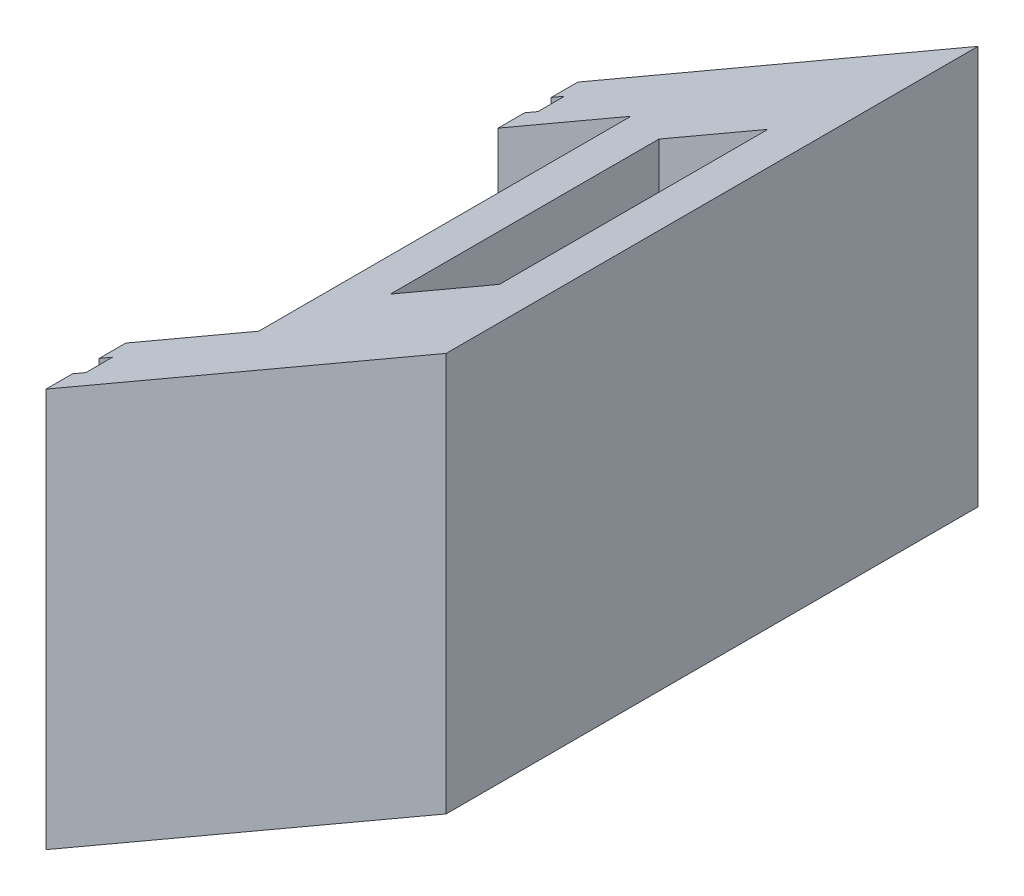
from build123d import *

# Parameters (mm, degrees)
SKETCH2_W             = 10
SKETCH2_H             = 20
BOSS_EXTRUDE1_DEPTH   = 15
SKETCH3_W             = 4.1
SKETCH3_H             = 10.1
CUT_EXTRUDE1_DEPTH    = 19.708286934
SKETCH4_W             = 2.95
SKETCH4_H             = 4.95
CUT_EXTRUDE2_DEPTH    = 15
SKETCH6_W             = 20
SKETCH6_H             = 15
BOSS_EXTRUDE2_DEPTH   = 3
BOSS_EXTRUDE3_DEPTH   = 5
CUT_EXTRUDE3_DEPTH    = 27.944433562
CUT_EXTRUDE4_DEPTH    = 0.5
BOSS_EXTRUDE6_START   = -10
BOSS_EXTRUDE6_DEPTH   = 20
BOSS_EXTRUDE6_2_DEPTH = 4.95
BOSS_EXTRUDE6_START_2 = 5.05
BOSS_EXTRUDE6_3_DEPTH = 4.95
BOSS_EXTRUDE6_4_DEPTH = 3
BOSS_EXTRUDE6_START_3 = 7
BOSS_EXTRUDE6_5_DEPTH = 3
BOSS_EXTRUDE6_6_DEPTH = 1
BOSS_EXTRUDE6_START_4 = -8
BOSS_EXTRUDE6_7_DEPTH = 1
BOSS_EXTRUDE6_8_DEPTH = 1
BOSS_EXTRUDE6_START_5 = 9
BOSS_EXTRUDE6_9_DEPTH = 1


# Read off the part's stored shape, not the designer's step: Boss-Extrude6
with BuildPart() as part:
    # Sketch2 → Boss-Extrude1 (new body)
    with BuildSketch(Plane(origin=(0, 0, 0), x_dir=(1, 0, 0), z_dir=(0, 1, 0))):
        Rectangle(SKETCH2_W, SKETCH2_H)
    extrude(amount=BOSS_EXTRUDE1_DEPTH)

    # Sketch3 → Cut-Extrude1 (cut, through all)
    with BuildSketch(Plane(origin=(0, 15, 0), x_dir=(1, 0, 0), z_dir=(0, 1, 0))):
        Rectangle(SKETCH3_W, SKETCH3_H)
    extrude(amount=-CUT_EXTRUDE1_DEPTH, mode=Mode.SUBTRACT)

    # Sketch4 → Cut-Extrude2 (cut)
    with BuildSketch(Plane(origin=(0, 15, 0), x_dir=(1, 0, 0), z_dir=(0, 1, 0))):
        Polygon((-2.05, 10), (-5, 10), (-5, -5.05), (-2.05, -5.05), (-2.05, 5.05), align=None)
        with Locations((-3.525, -7.525)):
            Rectangle(SKETCH4_W, SKETCH4_H)
    extrude(amount=-CUT_EXTRUDE2_DEPTH, mode=Mode.SUBTRACT)

    # Sketch6 → Boss-Extrude2 (add)
    with BuildSketch(Plane.ZY.offset(2.05)):
        with Locations((0, 7.5)):
            Rectangle(SKETCH6_W, SKETCH6_H)
    extrude(amount=BOSS_EXTRUDE2_DEPTH)

    # Sketch8 → Boss-Extrude3 (add)
    with BuildSketch(Plane.ZY.offset(5.05)):
        Polygon((-7, 15), (-10, 15), (-10, 0), (10, 0), (10, 15), (7, 15), (7, 3), (-7, 3), align=None)
    extrude(amount=BOSS_EXTRUDE3_DEPTH)

    # Sketch10 → Cut-Extrude3 (cut, through all)
    with BuildSketch(Plane.XY.offset(10)):
        Polygon((-10.05, 0), (5, 8.689121551), (5, 0), align=None)
    extrude(amount=-CUT_EXTRUDE3_DEPTH, mode=Mode.SUBTRACT)

    # Sketch11 → Cut-Extrude4 (cut)
    with BuildSketch(Plane.ZY.offset(10.05)):
        Polygon((-8, 2), (-8, 15), (-9, 15), (-9, 1), (0, 1), (9, 1), (9, 15), (8, 15), (8, 2), (0, 2), align=None)
    extrude(amount=-CUT_EXTRUDE4_DEPTH, mode=Mode.SUBTRACT)

    # Boss-Extrude6 outline → Boss-Extrude6 (add)
    with BuildSketch(Plane.XY.offset(BOSS_EXTRUDE6_START)):
        Polygon((-5.05, 17.886751346), (-5.05, 15), (-2.05, 15), (-2.05, 19.618802154), align=None)
        Polygon((2.05, 21.985938257), (2.05, 15), (5, 15), (5, 23.689121551), align=None)
    extrude(amount=BOSS_EXTRUDE6_DEPTH)

    # Boss-Extrude6 2 outline → Boss-Extrude6 2 (add)
    with BuildSketch(Plane.XY.offset(BOSS_EXTRUDE6_START)):
        Polygon((-2.05, 19.618802154), (-2.05, 15), (2.05, 15), (2.05, 21.985938257), align=None)
    extrude(amount=BOSS_EXTRUDE6_2_DEPTH)

    # Boss-Extrude6 3 outline → Boss-Extrude6 3 (add)
    with BuildSketch(Plane.XY.offset(BOSS_EXTRUDE6_START_2)):
        Polygon((-2.05, 19.618802154), (-2.05, 15), (2.05, 15), (2.05, 21.985938257), align=None)
    extrude(amount=BOSS_EXTRUDE6_3_DEPTH)

    # Boss-Extrude6 4 outline → Boss-Extrude6 4 (add)
    with BuildSketch(Plane.XY.offset(BOSS_EXTRUDE6_START)):
        Polygon((-9.55, 15), (-5.05, 15), (-5.05, 17.886751346), (-9.55, 15.288675135), align=None)
    extrude(amount=BOSS_EXTRUDE6_4_DEPTH)

    # Boss-Extrude6 5 outline → Boss-Extrude6 5 (add)
    with BuildSketch(Plane.XY.offset(BOSS_EXTRUDE6_START_3)):
        Polygon((-9.55, 15), (-5.05, 15), (-5.05, 17.886751346), (-9.55, 15.288675135), align=None)
    extrude(amount=BOSS_EXTRUDE6_5_DEPTH)

    # Boss-Extrude6 6 outline → Boss-Extrude6 6 (add)
    with BuildSketch(Plane.XY.offset(BOSS_EXTRUDE6_START)):
        Polygon((-10.05, 15), (-9.55, 15), (-9.55, 15.288675135), align=None)
    extrude(amount=BOSS_EXTRUDE6_6_DEPTH)

    # Boss-Extrude6 7 outline → Boss-Extrude6 7 (add)
    with BuildSketch(Plane.XY.offset(BOSS_EXTRUDE6_START_4)):
        Polygon((-10.05, 15), (-9.55, 15), (-9.55, 15.288675135), align=None)
    extrude(amount=BOSS_EXTRUDE6_7_DEPTH)

    # Boss-Extrude6 8 outline → Boss-Extrude6 8 (add)
    with BuildSketch(Plane.XY.offset(BOSS_EXTRUDE6_START_3)):
        Polygon((-10.05, 15), (-9.55, 15), (-9.55, 15.288675135), align=None)
    extrude(amount=BOSS_EXTRUDE6_8_DEPTH)

    # Boss-Extrude6 9 outline → Boss-Extrude6 9 (add)
    with BuildSketch(Plane.XY.offset(BOSS_EXTRUDE6_START_5)):
        Polygon((-10.05, 15), (-9.55, 15), (-9.55, 15.288675135), align=None)
    extrude(amount=BOSS_EXTRUDE6_9_DEPTH)


solid = part.part
